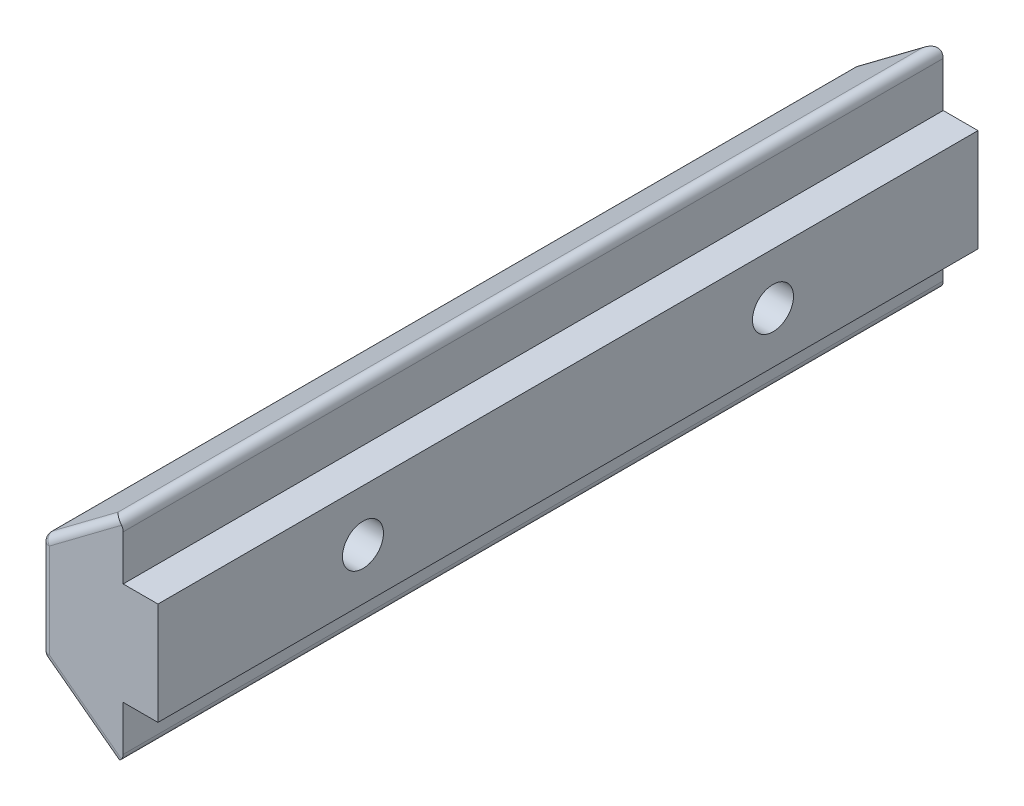
from build123d import *

# Parameters (mm, degrees)
BOSS_EXTRU_1_DEPTH         = 40
CONG_8_R                   = 0.4
ESQUISSE1_R                = 1
ENL_V_MAT_EXTRU_1_DEPTH    = 42.112073733
R_P_TITION_LIN_AIRE2_COUNT = 2
R_P_TITION_LIN_AIRE2_PITCH = 20


with BuildPart() as part:
    # ProfileRainureEsquisse → Boss.-Extru.1 (new body)
    with BuildSketch(Plane.XY):
        Polygon((0, 0), (0, 5), (4, 8), (4, 5), (5.695841166, 5), (5.695841166, 0), (4, 0), (4, -3), align=None)
    extrude(amount=BOSS_EXTRU_1_DEPTH)

    # Congé8
    cong_8_edges = [part.edges().sort_by_distance(p)[0] for p in [
        (4, 8, 20),
        (2, 6.5, 40),
        (2, 6.5, 0),
        (0, 5, 20),
        (0, 2.5, 40),
        (0, 2.5, 0),
        (0, 0, 20),
        (2, -1.5, 40),
        (4, -3, 20),
        (2, -1.5, 0),
    ]]
    fillet(cong_8_edges, radius=CONG_8_R)

    # Esquisse1 → Enlèv. mat.-Extru.1 (cut, through all)
    with BuildSketch(Plane(origin=(5.695841166, 0, 0), x_dir=(0, 0, -1), z_dir=(1, 0, 0))):
        with Locations((-30, 2.5)):
            Circle(ESQUISSE1_R)
    enl_v_mat_extru_1 = extrude(amount=-ENL_V_MAT_EXTRU_1_DEPTH, mode=Mode.SUBTRACT)

    # Répétition linéaire2: Enlèv. mat.-Extru.1 ×2
    with Locations(*[(0, 0, -i * R_P_TITION_LIN_AIRE2_PITCH) for i in range(1, R_P_TITION_LIN_AIRE2_COUNT)]):
        add(enl_v_mat_extru_1, mode=Mode.SUBTRACT)


solid = part.part
